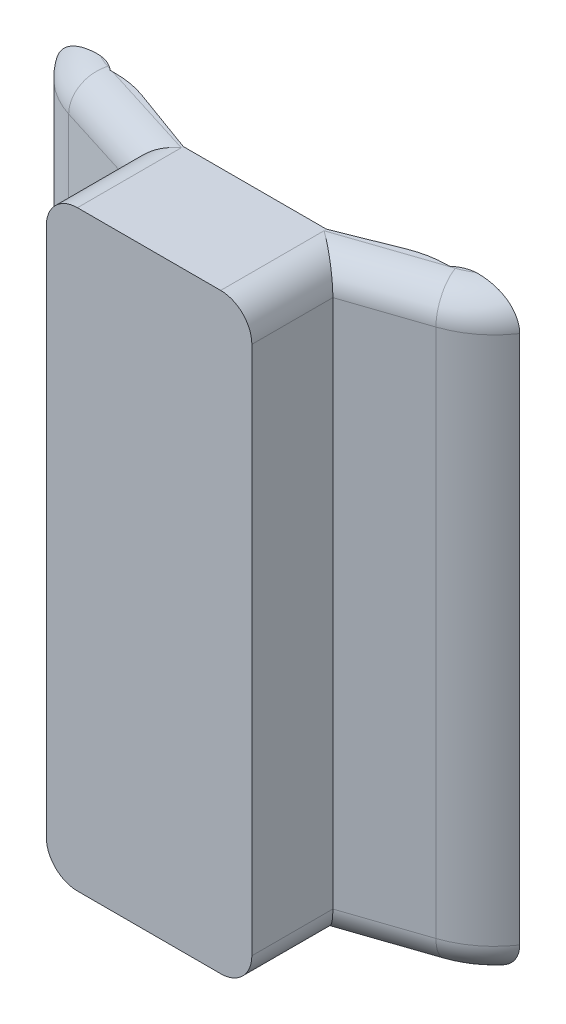
from build123d import *

# Parameters (mm, degrees)
BOSS_EXTRUDE5_DEPTH = 95
FILLET16_R          = 15
FILLET17_R          = 15
FILLET18_R          = 15
FILLET19_R          = 15
FILLET21_R          = 5
FILLET22_R          = 5
FILLET23_R          = 5
FILLET24_R          = 5
FILLET25_R          = 5
FILLET26_R          = 5
FILLET28_R          = 5
FILLET29_R          = 5
FILLET30_R          = 5
FILLET31_R          = 5


with BuildPart() as part:
    # Sketch2 → Boss-Extrude5 (new body)
    with BuildSketch(Plane(origin=(0, 0, 0), x_dir=(1, 0, 0), z_dir=(0, 1, 0))):
        Polygon((-11.5, 10.5), (11.453517933, 10.5), (23.299541019, 15.223771191), (26.5, 15.223771191), (26.5, 16.5), (36.5, 16.5), (36.5, 13.259608353), (16.5, 6.5), (16.5, -6.5), (-16.5, -6.5), (-16.5, 6.5), (-37.988921901, 13.259608353), (-37.988921901, 16.5), (-27.988921901, 16.5), (-27.970531324, 16.5), (-27.970531324, 16.440454109), (-27.970531324, 15.223771191), (-24.481649041, 15.223771191), align=None)
    extrude(amount=BOSS_EXTRUDE5_DEPTH)

    # Fillet16
    # the kernel refuses this fillet: 15 mm, written as the material it takes off along each edge
    with BuildSketch(Plane(origin=(36.5, -20.136972883, -13.259608353), x_dir=(-0.9473542933434234, 0, 0.3201871997500573), z_dir=(0, 1, 0))) as fillet16_piece_1:
        with BuildLine():
            CenterArc((8.054789153, -15), FILLET16_R, 90, 37.311981857)
            Line((-1.037531927, -3.069798938), (-1.219378349, -2.831194917))
            ThreePointArc((-1.219378349, -2.831194917), (-0.802972252, -1.438843309), (-0.284206288, 0.09605616))
            Line((-0.284206288, 0.09605616), (0, 0.3))
            Line((0, 0.3), (8.054789153, 0.3))
            Line((8.054789153, 0.3), (8.054789153, 0))
        make_face()
    extrude(amount=135.273945765, mode=Mode.SUBTRACT)

    # Fillet17
    # the kernel refuses this fillet: 15 mm, written as the material it takes off along each edge
    with BuildSketch(Plane(origin=(-37.988921901, -20.369568994, -13.259608353), x_dir=(0, 0, -1), z_dir=(0, 1, 0))) as fillet17_piece_1:
        with BuildLine():
            CenterArc((11.863879582, -12.273363672), FILLET17_R, 125.092573115, 37.445808138)
            Line((-2.444893018, -7.772360819), (-2.73106847, -7.682340761))
            Line((-2.73106847, -7.682340761), (-0.286175452, 0.090020057))
            Line((-0.286175452, 0.090020057), (0, 0.3))
            ThreePointArc((0, 0.3), (1.620195823, 0.3), (3.067921888, 0.245467273))
            Line((3.067921888, 0.245467273), (3.240391647, 0))
        make_face()
    extrude(amount=135.739137989, mode=Mode.SUBTRACT)

    # Fillet18
    fillet18_edges = [part.edges().sort_by_distance(p)[0] for p in [
        (23.299541019, 47.5, -15.223771191),
    ]]
    fillet(fillet18_edges, radius=FILLET18_R)

    # Fillet19
    fillet19_edges = [part.edges().sort_by_distance(p)[0] for p in [
        (-24.481649041, 47.5, -15.223771191),
    ]]
    fillet(fillet19_edges, radius=FILLET19_R)

    # Fillet21
    # the kernel refuses this fillet: 5 mm, written as the material it takes off along each edge
    with BuildSketch(Plane(origin=(26.5, -8.341735474, -16.5), x_dir=(0, 0, 1), z_dir=(0, 1, 0))) as fillet21_piece_1:
        with BuildLine():
            CenterArc((5, 3.33669419), FILLET21_R, 180, 41.862005804)
            Line((0, 3.33669419), (-0.1, 3.33669419))
            Line((-0.1, 3.33669419), (-0.1, 0))
            Line((-0.1, 0), (0, -0.1))
            ThreePointArc((0, -0.1), (0.638114404, -0.1), (1.201753385, -0.066733884))
            Line((1.201753385, -0.066733884), (1.276228809, 0))
        make_face()
    extrude(amount=111.683470949, mode=Mode.SUBTRACT)

    # Fillet22
    # the kernel refuses this fillet: 5 mm, written as the material it takes off along each edge
    with BuildSketch(Plane(origin=(-27.970531324, -8.341735474, -16.5), x_dir=(0, 0, 1), z_dir=(0, 1, 0))) as fillet22_piece_1:
        with BuildLine():
            CenterArc((5, -3.33669419), FILLET22_R, 138.137994196, 41.862005804)
            Line((0, -3.33669419), (-0.1, -3.33669419))
            Line((-0.1, -3.33669419), (-0.1, 0))
            Line((-0.1, 0), (0, 0.1))
            ThreePointArc((0, 0.1), (0.638114404, 0.1), (1.201753385, 0.066733884))
            Line((1.201753385, 0.066733884), (1.276228809, 0))
        make_face()
    extrude(amount=111.683470949, mode=Mode.SUBTRACT)

    # Fillet23
    # the kernel refuses this fillet: 5 mm, written as the material it takes off along each edge
    with BuildSketch(Plane(origin=(-4.576022833, 0, -2.749164289), x_dir=(0.3000668568991913, 0, -0.9539181733202489), z_dir=(-0.9539181733202489, 0, -0.3000668568991913))) as fillet23_piece_1_section:
        with BuildLine():
            CenterArc((FILLET23_R, -FILLET23_R), FILLET23_R, 90, 90)
            Line((0, -FILLET23_R), (-FILLET23_R * 0.02, -FILLET23_R))
            Line((-FILLET23_R * 0.02, -FILLET23_R), (-FILLET23_R * 0.02, FILLET23_R * 0.02))
            Line((-FILLET23_R * 0.02, FILLET23_R * 0.02), (FILLET23_R, FILLET23_R * 0.02))
            Line((FILLET23_R, FILLET23_R * 0.02), (FILLET23_R, 0))
        make_face()
    fillet23_piece_1 = extrude(amount=26.879179961, mode=Mode.PRIVATE)
    fillet23_piece_1 = split(fillet23_piece_1, bisect_by=Plane(origin=(-16.5, 1.14737311, -9.7645004), z_dir=(-1, 0, 0)), keep=Keep.TOP, mode=Mode.PRIVATE)
    add(fillet23_piece_1, mode=Mode.SUBTRACT)
    with BuildSketch(Plane(origin=(-25.715558229, 0, -25.123487935), x_dir=(-0.3000668568991974, 0, 0.9539181733202469), z_dir=(0.9539181733202469, 0, 0.3000668568991974))) as fillet23_piece_2_section:
        with BuildLine():
            CenterArc((15 - FILLET23_R, -FILLET23_R), FILLET23_R, 0, 90)
            Line((15, -FILLET23_R), (15 + FILLET23_R * 0.02, -FILLET23_R))
            Line((15 + FILLET23_R * 0.02, -FILLET23_R), (15 + FILLET23_R * 0.02, FILLET23_R * 0.02))
            Line((15 + FILLET23_R * 0.02, FILLET23_R * 0.02), (15 - FILLET23_R, FILLET23_R * 0.02))
            Line((15 - FILLET23_R, FILLET23_R * 0.02), (15 - FILLET23_R, 0))
        make_face()
    fillet23_piece_2 = revolve(axis=Axis((-25.715558229, 0, -25.123487935), (0, -1, 0)), revolution_arc=85.195610564, mode=Mode.PRIVATE)
    fillet23_piece_2 = split(fillet23_piece_2, bisect_by=Plane(origin=(-33.617328681, 1.250053693, -16.5), z_dir=(0, 0, 1)), keep=Keep.TOP, mode=Mode.PRIVATE)
    add(fillet23_piece_2, mode=Mode.SUBTRACT)

    # Fillet24
    fillet24_edges = [part.edges().sort_by_distance(p)[0] for p in [
        (22.684630457, 0, -8.590283985),
        (33.162574695, 0, -12.963578877),
    ]]
    fillet(fillet24_edges, radius=FILLET24_R)

    # Fillet25
    fillet25_edges = [part.edges().sort_by_distance(p)[0] for p in [
        (33.162574695, 95, -12.963578877),
        (22.684630457, 95, -8.590283985),
    ]]
    fillet(fillet25_edges, radius=FILLET25_R)

    # Fillet26
    # the kernel refuses this fillet: 5 mm, written as the material it takes off along each edge
    with BuildSketch(Plane(origin=(-25.715558229, 95, -25.123487935), x_dir=(-0.3000668568991974, 0, 0.9539181733202469), z_dir=(0.9539181733202469, 0, 0.3000668568991974))) as fillet26_piece_1:
        with BuildLine():
            CenterArc((15 - FILLET26_R, FILLET26_R), FILLET26_R, 270, 90)
            Line((15, FILLET26_R), (15, 0))
            Line((15, 0), (15 - FILLET26_R, 0))
        make_face()
    revolve(axis=Axis((-25.715558229, 95, -25.123487935), (0, -1, 0)), revolution_arc=85.195610564, mode=Mode.SUBTRACT)
    with BuildSketch(Plane(origin=(-4.576022833, 95, -2.749164289), x_dir=(0.3000668568991913, 0, -0.9539181733202489), z_dir=(-0.9539181733202489, 0, -0.3000668568991913))) as fillet26_piece_2_section:
        with BuildLine():
            CenterArc((FILLET26_R, FILLET26_R), FILLET26_R, 180, 90)
            Line((0, FILLET26_R), (0, 0))
            Line((0, 0), (FILLET26_R, 0))
        make_face()
    fillet26_piece_2 = extrude(amount=26.879179961, mode=Mode.PRIVATE)
    fillet26_piece_2 = split(fillet26_piece_2, bisect_by=Plane(origin=(-16.5, 93.85262689, -9.7645004), z_dir=(-1, 0, 0)), keep=Keep.TOP, mode=Mode.PRIVATE)
    add(fillet26_piece_2, mode=Mode.SUBTRACT)

    # Fillet28
    fillet28_edges = [part.edges().sort_by_distance(p)[0] for p in [
        (16.5, 0, -2.638928242),
    ]]
    fillet(fillet28_edges, radius=FILLET28_R)

    # Fillet29
    fillet29_edges = [part.edges().sort_by_distance(p)[0] for p in [
        (-16.5, 0, -2.620769863),
    ]]
    fillet(fillet29_edges, radius=FILLET29_R)

    # Fillet30
    fillet30_edges = [part.edges().sort_by_distance(p)[0] for p in [
        (-16.5, 95, -2.620769863),
    ]]
    fillet(fillet30_edges, radius=FILLET30_R)

    # Fillet31
    fillet31_edges = [part.edges().sort_by_distance(p)[0] for p in [
        (16.5, 95, -2.638928242),
    ]]
    fillet(fillet31_edges, radius=FILLET31_R)


solid = part.part
